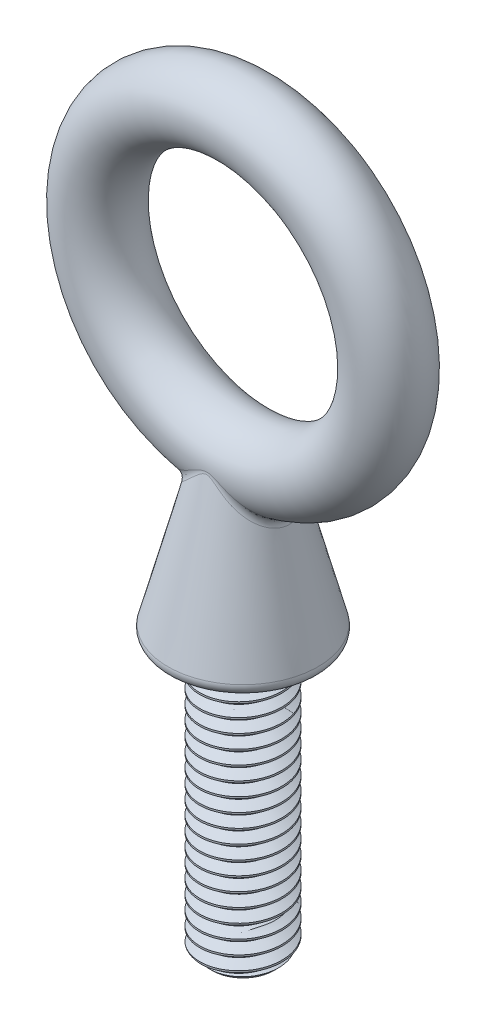
from build123d import *
from build123d.topology import SkipClean

# Parameters (mm, degrees)
BOSS_EXTRUDE1_START = -35.321875
SKETCH2_R           = 4.7625
BOSS_EXTRUDE1_DEPTH = 31.75
SKETCH5_OUTSIDE_W   = 85.336
SKETCH5_OUTSIDE_H   = 85.336
SKETCH5_OUTSIDE_R   = 3.559536588
CUT_EXTRUDE1_DEPTH  = 33.456514177
CUT_EXTRUDE1_DRAFT  = -45
SKETCH6_R           = 4.1671875
FILLET1_R           = 1.041796875
CUT_SWEEP1_PITCH    = 1.5875
CUT_SWEEP1_TO       = 31.75
SKETCH9_R           = 4.7625
BOSS_EXTRUDE2_DEPTH = 2.54
BOSS_EXTRUDE2_TAPER = 45


with BuildPart() as part:
    # Sketch2 → Boss-Extrude1 (new body)
    with BuildSketch(Plane(origin=(0, 0, 0), x_dir=(1, 0, 0), z_dir=(0, 1, 0)).offset(BOSS_EXTRUDE1_START)):
        with Locations(Location((0, 0, 0), (0, 0, 270))):
            Circle(SKETCH2_R)
    extrude(amount=-BOSS_EXTRUDE1_DEPTH)


with BuildPart() as cut_extrude1_tool:
    # Sketch5 outside → Cut-Extrude1 (with draft: the straight prism first)
    with BuildSketch(Plane.XZ.offset(67.071875)):
        Rectangle(SKETCH5_OUTSIDE_W, SKETCH5_OUTSIDE_H)
        Circle(SKETCH5_OUTSIDE_R, mode=Mode.SUBTRACT)
    extrude(amount=-CUT_EXTRUDE1_DEPTH)
    # Cut-Extrude1: the draft: its side faces are tilted about the plane it starts from
    cut_extrude1_sides = [cut_extrude1_tool.faces().sort_by_distance(p)[0] for p in [
        (0, -50.343617912, -42.668),
        (42.668, -50.343617912, 0),
        (0, -50.343617912, 42.668),
        (-42.668, -50.343617912, 0),
        (-3.559536588, -50.343617912, 0),
    ]]
    draft(cut_extrude1_sides, Plane.XZ.offset(67.071875), CUT_EXTRUDE1_DRAFT)


with BuildPart() as part_1:
    add(part.part)

    # Cut-Extrude1: cut by cut_extrude1_tool
    add(cut_extrude1_tool.part, mode=Mode.SUBTRACT)



with BuildPart() as body_2:
    # Sketch6 → Revolve1 (revolve)
    with BuildSketch(Plane(origin=(0, 0, 0), x_dir=(0, 0, -1), z_dir=(1, 0, 0)), mode=Mode.PRIVATE) as revolve1_sk:
        with Locations((0, 16.8671875)):
            Circle(SKETCH6_R)
    revolve(revolve1_sk.sketch.rotate(Axis((0, 0, -7.63984375), (0, 0, 1)), 90), axis=Axis((0, 0, -7.63984375), (0, 0, 1)))


with BuildPart() as part_2:
    with SkipClean():  # the faces are left unmerged after this step: merging them gives an invalid solid
        add(part_1.part)

        add(body_2.part)  # Revolve2 merges body 2
        # Sketch8 → Revolve2 (revolve)
        with BuildSketch(Plane.XY, mode=Mode.PRIVATE) as revolve2_sk:
            with BuildLine():
                Line((0, -35.321875), (0, -16.8671875))
                Line((0, -16.8671875), (-4.1671875, -16.8671875))
                Line((-4.1671875, -16.8671875), (-8.696699364, -34.014003432))
                ThreePointArc((-8.696699364, -34.014003432), (-8.514842885, -34.915745076), (-7.689453125, -35.321875))
                Line((-7.689453125, -35.321875), (0, -35.321875))
            make_face()
        revolve(revolve2_sk.sketch.rotate(Axis((0, -35.321875, 0), (0, 1, 0)), 270), axis=Axis((0, -35.321875, 0), (0, 1, 0)))

    # Fillet1
    fillet1_edges = [part_2.edges().sort_by_distance(p)[0] for p in [
        (5.102060777, -20.406222273, 1.0424e-05),
    ]]
    fillet(fillet1_edges, radius=FILLET1_R)


with BuildPart() as body_2_2:
    # Split1: the piece on the far side of the plane
    add(part_2.part)
    split(bisect_by=Plane(origin=(0, -35.321875, 0), x_dir=(-1, 0, 0), z_dir=(0, -1, 0)), keep=Keep.BOTTOM)


with BuildPart() as part_3:
    add(part_2.part)

    # Split1
    split(bisect_by=Plane(origin=(0, -35.321875, 0), x_dir=(-1, 0, 0), z_dir=(0, -1, 0)), keep=Keep.TOP)

    # Cut-Sweep1: arcs per turn and ends read off the stored shape
    # Cut-Sweep1: the profile of Sketch4 screwed along a right-hand helix through 21 turns, 8 arcs to a turn; built about Z, then put on its axis
    cut_sweep1_z = Axis((0, 0, 0), (0, 0, 1))
    cut_sweep1_corners = [(3.731388504, 0, -0.5953125), (3.731388504, 0, -0.79375), (4.848425958, 0, -1.438671875), (4.848425958, 0, 0.049609375)]
    with BuildLine(mode=Mode.PRIVATE) as cut_sweep1_profile:
        Line(cut_sweep1_corners[0], cut_sweep1_corners[1])
        Line(cut_sweep1_corners[1], cut_sweep1_corners[2])
        Line(cut_sweep1_corners[2], cut_sweep1_corners[3])
        Line(cut_sweep1_corners[3], cut_sweep1_corners[0])
    cut_sweep1_cap = Face(cut_sweep1_profile.wire())
    cut_sweep1_turn_angles = [0, 22.5, 45, 67.5, 90, 112.5, 135, 157.5, 180, 202.5, 225, 247.5, 270, 292.5, 315, 337.5, 360]
    cut_sweep1_turn_weights = [1, 0.9238795325112867, 1, 0.9238795325112867, 1, 0.9238795325112867, 1, 0.9238795325112867, 1, 0.9238795325112867, 1, 0.9238795325112867, 1, 0.9238795325112867, 1, 0.9238795325112867, 1]
    cut_sweep1_turn_rails = [Edge.make_bspline([Vector(p[0], p[1], 0).rotate(cut_sweep1_z, cut_sweep1_turn_angles[k]) / cut_sweep1_turn_weights[k] + Vector(0, 0, p[2] + CUT_SWEEP1_PITCH * cut_sweep1_turn_angles[k] / 360) for k in range(17)], [0, 0, 0, 1, 1, 2, 2, 3, 3, 4, 4, 5, 5, 6, 6, 7, 7, 8, 8, 8], 2, cut_sweep1_turn_weights) for p in cut_sweep1_corners]
    cut_sweep1_turn_sides = [Face.make_surface_from_curves(cut_sweep1_turn_rails[p[0]], cut_sweep1_turn_rails[p[1]]) for p in [(0, 1), (1, 2), (2, 3), (3, 0)]]
    cut_sweep1 = Plane(origin=(0, -67.071875, 0), x_dir=(1, 0, 0), z_dir=(0, 1, 0)) * split(Solid(Shell([*[p.moved(Location((0, 0, CUT_SWEEP1_PITCH * i))) for i in range(21) for p in cut_sweep1_turn_sides], cut_sweep1_cap, cut_sweep1_cap.rotate(cut_sweep1_z, 7560).moved(Location((0, 0, CUT_SWEEP1_PITCH * 7560 / 360)))])), bisect_by=Plane.XY.offset(CUT_SWEEP1_TO), keep=Keep.BOTTOM, mode=Mode.PRIVATE)
    add(cut_sweep1, mode=Mode.SUBTRACT)

    add(body_2_2.part)  # Boss-Extrude2 merges body 2 2
    # Sketch9 → Boss-Extrude2 (add)
    with BuildSketch(Plane.XZ.offset(35.321875)):
        Circle(SKETCH9_R)
    extrude(amount=BOSS_EXTRUDE2_DEPTH, taper=BOSS_EXTRUDE2_TAPER)


solid = part_3.part
